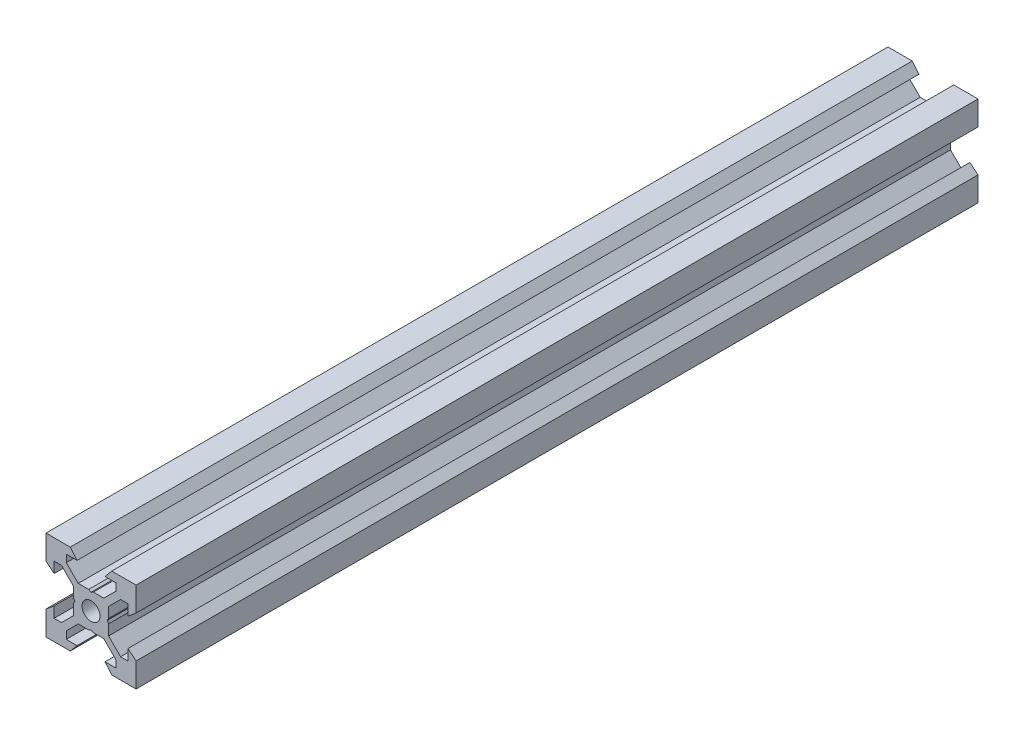
from build123d import *

# Parameters (mm, degrees)
SKETCH1_R           = 2
BOSS_EXTRUDE1_DEPTH = 93.5


with BuildPart() as part:
    # Sketch1 → Boss-Extrude1 (new, symmetric)
    with BuildSketch(Plane.XY):
        Polygon((10, 4.610379336), (10, 10), (4.610379336, 10), (3.1, 8.2), (5.5, 8.2), (5.5, 6.560660172), (2.839339828, 3.9), (0.519615242, 3.9), (0, 3.6), (-0.519615242, 3.9), (-2.839339828, 3.9), (-5.5, 6.560660172), (-5.5, 8.2), (-3.1, 8.2), (-4.610379336, 10), (-10, 10), (-10, 4.610379336), (-8.2, 3.1), (-8.2, 5.5), (-6.560660172, 5.5), (-3.9, 2.839339828), (-3.9, 0.519615242), (-3.6, 0), (-3.9, -0.519615242), (-3.9, -2.839339828), (-6.560660172, -5.5), (-8.2, -5.5), (-8.2, -3.1), (-10, -4.610379336), (-10, -10), (-4.610379336, -10), (-3.1, -8.2), (-5.5, -8.2), (-5.5, -6.560660172), (-2.839339828, -3.9), (-0.519615242, -3.9), (0, -3.6), (0.519615242, -3.9), (2.839339828, -3.9), (5.5, -6.560660172), (5.5, -8.2), (3.1, -8.2), (4.610379336, -10), (10, -10), (10, -4.610379336), (8.2, -3.1), (8.2, -5.5), (6.560660172, -5.5), (3.9, -2.839339828), (3.9, -0.519615242), (3.6, 0), (3.9, 0.519615242), (3.9, 2.839339828), (6.560660172, 5.5), (8.2, 5.5), (8.2, 3.1), align=None)
        Circle(SKETCH1_R, mode=Mode.SUBTRACT)
    extrude(amount=BOSS_EXTRUDE1_DEPTH, both=True)


solid = part.part
